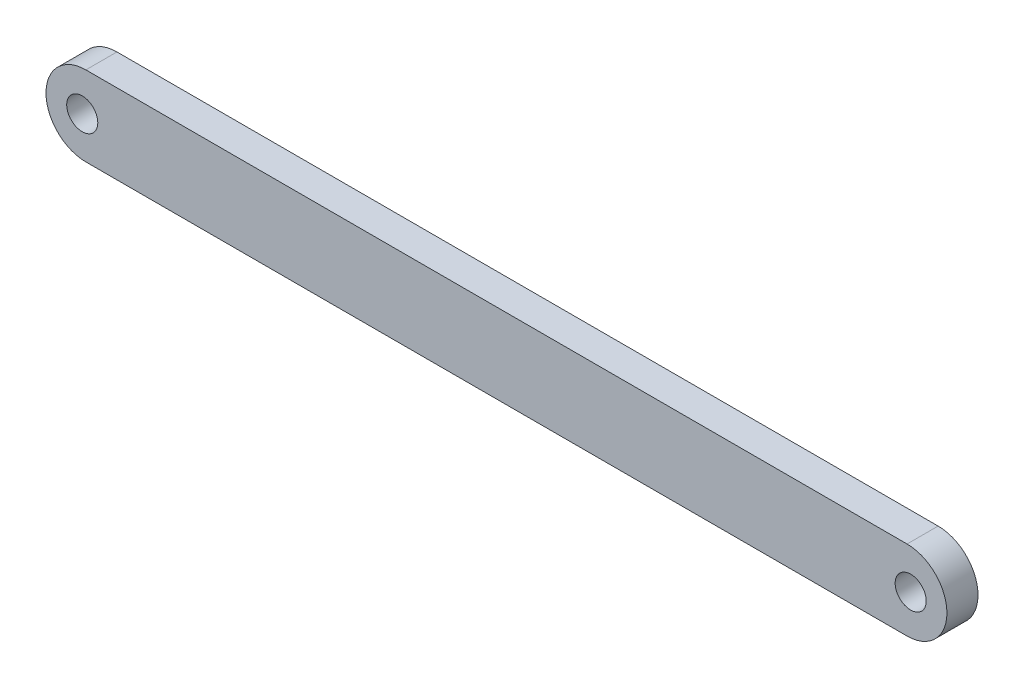
from build123d import *

# Parameters (mm, degrees)
ESQUISSE1_R               = 1.5
T_LE_DE_BASE_PLI_E1_DEPTH = 3


# Sheet-metal steps are written as plain solids
with BuildPart() as part:
    # Esquisse1 → Tôle de base pliée1 (new body)
    with BuildSketch(Plane.XY):
        with BuildLine():
            Line((-83.15, 7.7), (-3.85, 7.7))
            ThreePointArc((-3.85, 7.7), (0, 3.85), (-3.85, 0))
            Line((-3.85, 0), (-83.15, 0))
            ThreePointArc((-83.15, 0), (-87, 3.85), (-83.15, 7.7))
        make_face()
        with Locations((-3.5, 3.85)):
            Circle(ESQUISSE1_R, mode=Mode.SUBTRACT)
        with Locations((-83.5, 3.85)):
            Circle(ESQUISSE1_R, mode=Mode.SUBTRACT)
    extrude(amount=-T_LE_DE_BASE_PLI_E1_DEPTH)


solid = part.part
